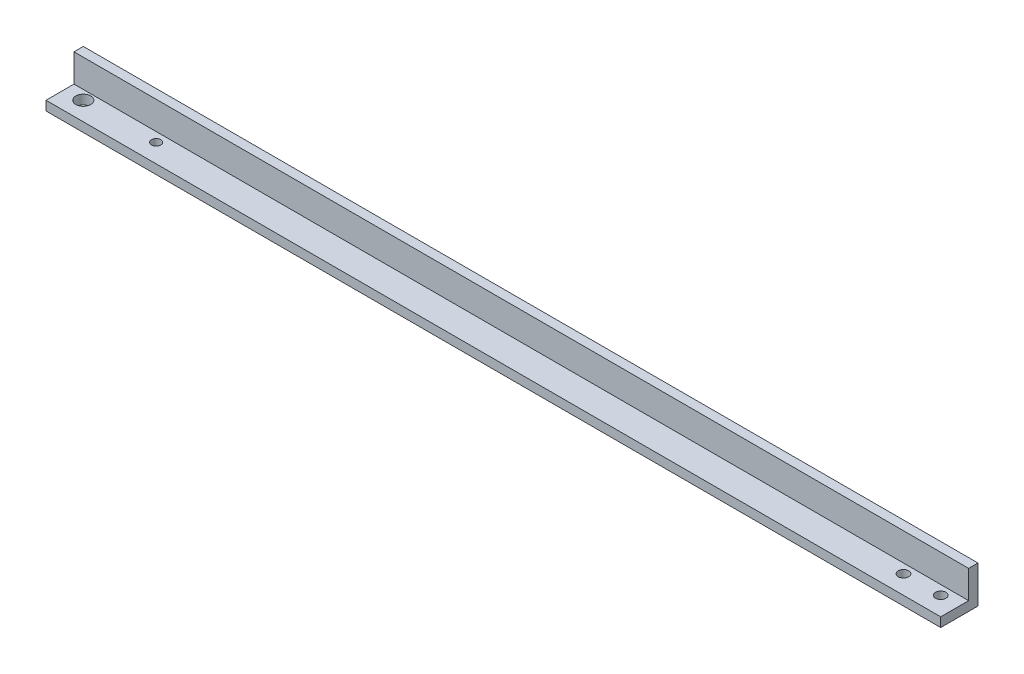
from build123d import *

# Parameters (mm, degrees)
BOSS_EXTRUDE1_DEPTH = 609.6
SKETCH2_R           = 5.08
SKETCH2_R_2         = 3.175
SKETCH2_R_3         = 3.556
CUT_EXTRUDE1_DEPTH  = 914.4


with BuildPart() as part:
    # Sketch1 → Boss-Extrude1 (new body)
    with BuildSketch(Plane(origin=(0, 0, 0), x_dir=(0, 0, -1), z_dir=(1, 0, 0))):
        Polygon((0, 0), (0, 19.05), (6.35, 19.05), (6.35, -6.35), (-19.05, -6.35), (-19.05, 0), align=None)
    extrude(amount=BOSS_EXTRUDE1_DEPTH)

    # Sketch2 → Cut-Extrude1 (cut)
    with BuildSketch(Plane.XZ.offset(6.35)):
        with Locations((12.7, 6.35)):
            Circle(SKETCH2_R)
        with Locations((62.357, 6.35)):
            Circle(SKETCH2_R_2)
        with Locations((596.9, 6.35)):
            Circle(SKETCH2_R_3)
        with Locations((571.5, 6.35)):
            Circle(SKETCH2_R_3)
    extrude(amount=-CUT_EXTRUDE1_DEPTH, mode=Mode.SUBTRACT)


solid = part.part
